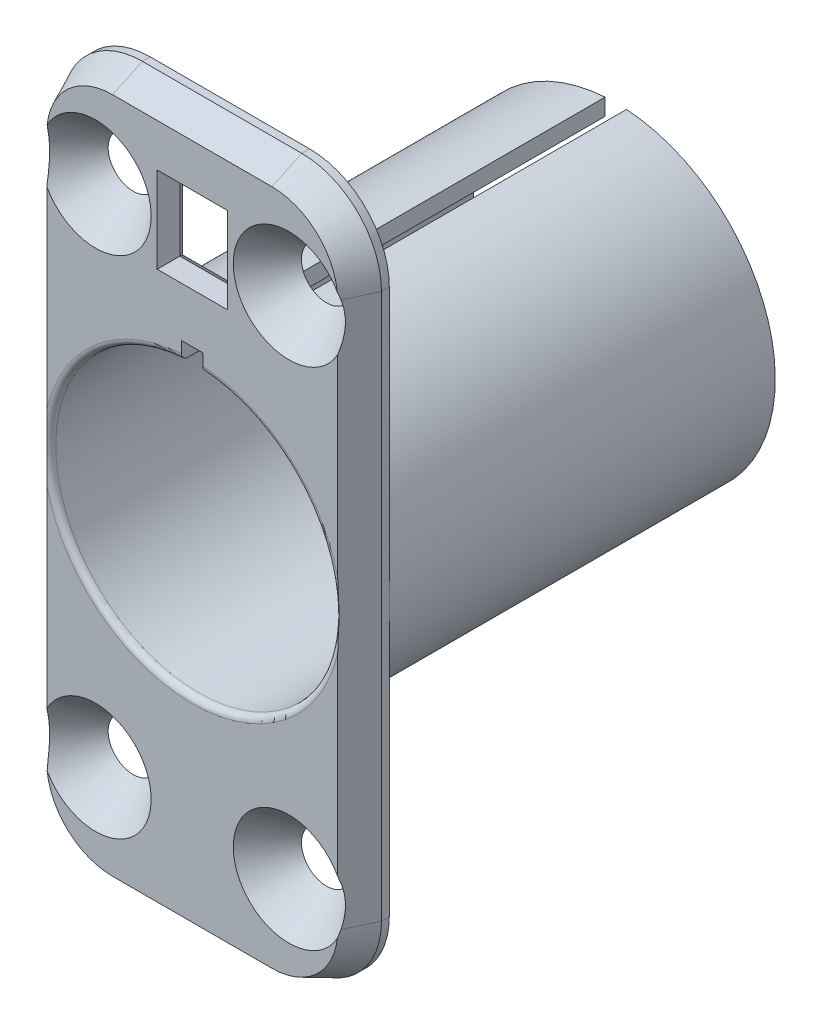
from build123d import *
from OCP.BRepFilletAPI import BRepFilletAPI_MakeChamfer

# Parameters (mm, degrees)
BOSS_EXTRUDE1_DEPTH = 3
SKETCH2_R           = 2
CUT_EXTRUDE1_DEPTH  = 31.959580504
CHAMFER1_SIZE       = 2.38
CHAMFER1_SIZE2      = 1.109812226
SKETCH3_R           = 12.7
SKETCH3_R_2         = 11.375
BOSS_EXTRUDE2_DEPTH = 30.75
SKETCH5_W           = 5.58
SKETCH5_H           = 6.85
CUT_EXTRUDE3_DEPTH  = 10
CHAMFER3_SIZE       = 1
CHAMFER3_SIZE2      = 1.191753593
CUT_EXTRUDE4_START  = -5
SKETCH6_R           = 11.375
CUT_EXTRUDE4_DEPTH  = 5
CHAMFER4_SIZE       = 2.4293521
CHAMFER4_SIZE_2     = 3
FILLET1_R           = 0.5
CUT_EXTRUDE6_START  = -35
CUT_EXTRUDE6_DEPTH  = 35


with BuildPart() as part:
    # Sketch1 → Boss-Extrude1 (new body)
    with BuildSketch(Plane.XY):
        with BuildLine():
            Line((6.35, 28.075), (-6.35, 28.075))
            ThreePointArc((-6.35, 28.075), (-10.840128061, 26.215128061), (-12.7, 21.725))
            Line((-12.7, 21.725), (-12.7, -21.725))
            ThreePointArc((-12.7, -21.725), (-10.840128061, -26.215128061), (-6.35, -28.075))
            Line((-6.35, -28.075), (6.35, -28.075))
            ThreePointArc((6.35, -28.075), (10.840128061, -26.215128061), (12.7, -21.725))
            Line((12.7, -21.725), (12.7, 21.725))
            ThreePointArc((12.7, 21.725), (10.840128061, 26.215128061), (6.35, 28.075))
        make_face()
    extrude(amount=BOSS_EXTRUDE1_DEPTH)

    # Sketch2 → Cut-Extrude1 (cut, through all)
    with BuildSketch(Plane(origin=(0, 0, 0), x_dir=(-1, 0, 0), z_dir=(0, 0, -1))):
        with Locations((-7.7, -20.125)):
            Circle(SKETCH2_R)
        with Locations((-7.7, 20.125)):
            Circle(SKETCH2_R)
        with Locations((7.7, 20.125)):
            Circle(SKETCH2_R)
        with Locations((7.7, -20.125)):
            Circle(SKETCH2_R)
    extrude(amount=-CUT_EXTRUDE1_DEPTH, mode=Mode.SUBTRACT)

    # Chamfer1: one chamfer whose edges measure the first distance from different faces: ONE call of the kernel's chamfer builder (chamfer() names one face for all edges)
    chamfer1_edges_1 = [part.edges().sort_by_distance(p)[0] for p in [
        (-10.840128061, 26.215128061, 3),
    ]]
    chamfer1_side_1 = [part.faces().sort_by_distance(p)[0] for p in [
        (-10.840128061, 26.215128061, 1.5),
    ]]
    chamfer1_edges_2 = [part.edges().sort_by_distance(p)[0] for p in [
        (-12.7, 0, 3),
    ]]
    chamfer1_side_2 = [part.faces().sort_by_distance(p)[0] for p in [
        (-12.7, 0, 1.5),
    ]]
    chamfer1_edges_3 = [part.edges().sort_by_distance(p)[0] for p in [
        (-10.840128061, -26.215128061, 3),
    ]]
    chamfer1_side_3 = [part.faces().sort_by_distance(p)[0] for p in [
        (-10.840128061, -26.215128061, 1.5),
    ]]
    chamfer1_edges_4 = [part.edges().sort_by_distance(p)[0] for p in [
        (0, -28.075, 3),
    ]]
    chamfer1_side_4 = [part.faces().sort_by_distance(p)[0] for p in [
        (0, -28.075, 1.5),
    ]]
    chamfer1_edges_5 = [part.edges().sort_by_distance(p)[0] for p in [
        (10.840128061, -26.215128061, 3),
    ]]
    chamfer1_side_5 = [part.faces().sort_by_distance(p)[0] for p in [
        (10.840128061, -26.215128061, 1.5),
    ]]
    chamfer1_edges_6 = [part.edges().sort_by_distance(p)[0] for p in [
        (12.7, 0, 3),
    ]]
    chamfer1_side_6 = [part.faces().sort_by_distance(p)[0] for p in [
        (12.7, 0, 1.5),
    ]]
    chamfer1_edges_7 = [part.edges().sort_by_distance(p)[0] for p in [
        (10.840128061, 26.215128061, 3),
    ]]
    chamfer1_side_7 = [part.faces().sort_by_distance(p)[0] for p in [
        (10.840128061, 26.215128061, 1.5),
    ]]
    chamfer1_edges_8 = [part.edges().sort_by_distance(p)[0] for p in [
        (0, 28.075, 3),
    ]]
    chamfer1_side_8 = [part.faces().sort_by_distance(p)[0] for p in [
        (0, 28.075, 1.5),
    ]]
    chamfer1 = BRepFilletAPI_MakeChamfer(part.part.solid().wrapped)
    for e in chamfer1_edges_1:
        chamfer1.Add(CHAMFER1_SIZE, CHAMFER1_SIZE2, e.wrapped, chamfer1_side_1[0].wrapped)  # the first distance lies on this face
    for e in chamfer1_edges_2:
        chamfer1.Add(CHAMFER1_SIZE, CHAMFER1_SIZE2, e.wrapped, chamfer1_side_2[0].wrapped)  # the first distance lies on this face
    for e in chamfer1_edges_3:
        chamfer1.Add(CHAMFER1_SIZE, CHAMFER1_SIZE2, e.wrapped, chamfer1_side_3[0].wrapped)  # the first distance lies on this face
    for e in chamfer1_edges_4:
        chamfer1.Add(CHAMFER1_SIZE, CHAMFER1_SIZE2, e.wrapped, chamfer1_side_4[0].wrapped)  # the first distance lies on this face
    for e in chamfer1_edges_5:
        chamfer1.Add(CHAMFER1_SIZE, CHAMFER1_SIZE2, e.wrapped, chamfer1_side_5[0].wrapped)  # the first distance lies on this face
    for e in chamfer1_edges_6:
        chamfer1.Add(CHAMFER1_SIZE, CHAMFER1_SIZE2, e.wrapped, chamfer1_side_6[0].wrapped)  # the first distance lies on this face
    for e in chamfer1_edges_7:
        chamfer1.Add(CHAMFER1_SIZE, CHAMFER1_SIZE2, e.wrapped, chamfer1_side_7[0].wrapped)  # the first distance lies on this face
    for e in chamfer1_edges_8:
        chamfer1.Add(CHAMFER1_SIZE, CHAMFER1_SIZE2, e.wrapped, chamfer1_side_8[0].wrapped)  # the first distance lies on this face
    add(Compound.cast(chamfer1.Shape()), mode=Mode.REPLACE)

    # Sketch3 → Boss-Extrude2 (add)
    with BuildSketch(Plane(origin=(0, 0, 0), x_dir=(-1, 0, 0), z_dir=(0, 0, -1))):
        Circle(SKETCH3_R)
        Circle(SKETCH3_R_2, mode=Mode.SUBTRACT)
    extrude(amount=BOSS_EXTRUDE2_DEPTH)

    # Sketch5 → Cut-Extrude3 (cut)
    with BuildSketch(Plane.XY.offset(3)):
        with Locations((-0.000187774, 20.125)):
            Rectangle(SKETCH5_W, SKETCH5_H)
    extrude(amount=-CUT_EXTRUDE3_DEPTH, mode=Mode.SUBTRACT)

    # Chamfer3
    chamfer3_edges = [part.edges().sort_by_distance(p)[0] for p in [
        (2.789812226, 20.125, 0),
        (-0.000187774, 16.7, 0),
        (-2.790187774, 20.125, 0),
        (-0.000187774, 23.55, 0),
    ]]
    chamfer3_side = [part.faces().sort_by_distance(p)[0] for p in [
        (10.572418738, 25.947418738, 0),
    ]]
    chamfer(chamfer3_edges, length=CHAMFER3_SIZE, length2=CHAMFER3_SIZE2, reference=chamfer3_side[0])

    # Sketch6 → Cut-Extrude4 (cut)
    with BuildSketch(Plane(origin=(0, 0, 0), x_dir=(-1, 0, 0), z_dir=(0, 0, -1)).offset(CUT_EXTRUDE4_START)):
        Circle(SKETCH6_R)
    extrude(amount=CUT_EXTRUDE4_DEPTH, mode=Mode.SUBTRACT)

    # Chamfer4
    # the kernel refuses this chamfer: 3, 2.4293521 mm, written as the material it takes off along each edge
    with BuildSketch(Plane(origin=(7.7, -20.125, 3), x_dir=(-1, 0, 0), z_dir=(0, -1, 0))) as chamfer4_piece_1:
        Polygon((2 + CHAMFER4_SIZE, 0), (2, CHAMFER4_SIZE_2), (2, 0), align=None)
    revolve(axis=Axis((7.7, -20.125, 3), (0, 0, -1)), mode=Mode.SUBTRACT)
    with BuildSketch(Plane(origin=(-7.7, 20.125, 3), x_dir=(-1, 0, 0), z_dir=(0, -1, 0))) as chamfer4_piece_2:
        Polygon((2 + CHAMFER4_SIZE, 0), (2, CHAMFER4_SIZE_2), (2, 0), align=None)
    revolve(axis=Axis((-7.7, 20.125, 3), (0, 0, -1)), mode=Mode.SUBTRACT)
    with BuildSketch(Plane(origin=(-7.7, -20.125, 3), x_dir=(-1, 0, 0), z_dir=(0, -1, 0))) as chamfer4_piece_3:
        Polygon((2 + CHAMFER4_SIZE, 0), (2, CHAMFER4_SIZE_2), (2, 0), align=None)
    revolve(axis=Axis((-7.7, -20.125, 3), (0, 0, -1)), mode=Mode.SUBTRACT)
    with BuildSketch(Plane(origin=(7.7, 20.125, 3), x_dir=(-1, 0, 0), z_dir=(0, -1, 0))) as chamfer4_piece_4:
        Polygon((2, CHAMFER4_SIZE_2), (2 + CHAMFER4_SIZE, 0), (2, 0), align=None)
    revolve(axis=Axis((7.7, 20.125, 3), (0, 0, -1)), mode=Mode.SUBTRACT)

    # Fillet1
    # the kernel refuses this fillet: 0.5 mm, written as the material it takes off along each edge
    with BuildSketch(Plane(origin=(0, 0, 3), x_dir=(-1, 0, 0), z_dir=(0, 1, 0))) as fillet1_piece_1:
        with BuildLine():
            CenterArc((11.375 + FILLET1_R, -FILLET1_R), FILLET1_R, 90, 90)
            Line((11.375, -FILLET1_R), (11.375, 0))
            Line((11.375, 0), (11.375 + FILLET1_R, 0))
        make_face()
    revolve(axis=Axis((0, 0, 3), (0, 0, 1)), mode=Mode.SUBTRACT)

    # Sketch7 → Cut-Extrude6 (cut)
    with BuildSketch(Plane(origin=(0, 0, -30.75), x_dir=(-1, 0, 0), z_dir=(0, 0, -1)).offset(CUT_EXTRUDE6_START)):
        with BuildLine():
            Line((-0.85, 11.343197301), (-0.85, 12.75))
            Line((-0.85, 12.75), (0.85, 12.75))
            Line((0.85, 12.75), (0.85, 11.343197301))
            ThreePointArc((0.85, 11.343197301), (0, 11.375), (-0.85, 11.343197301))
        make_face()
    extrude(amount=CUT_EXTRUDE6_DEPTH, mode=Mode.SUBTRACT)


solid = part.part
